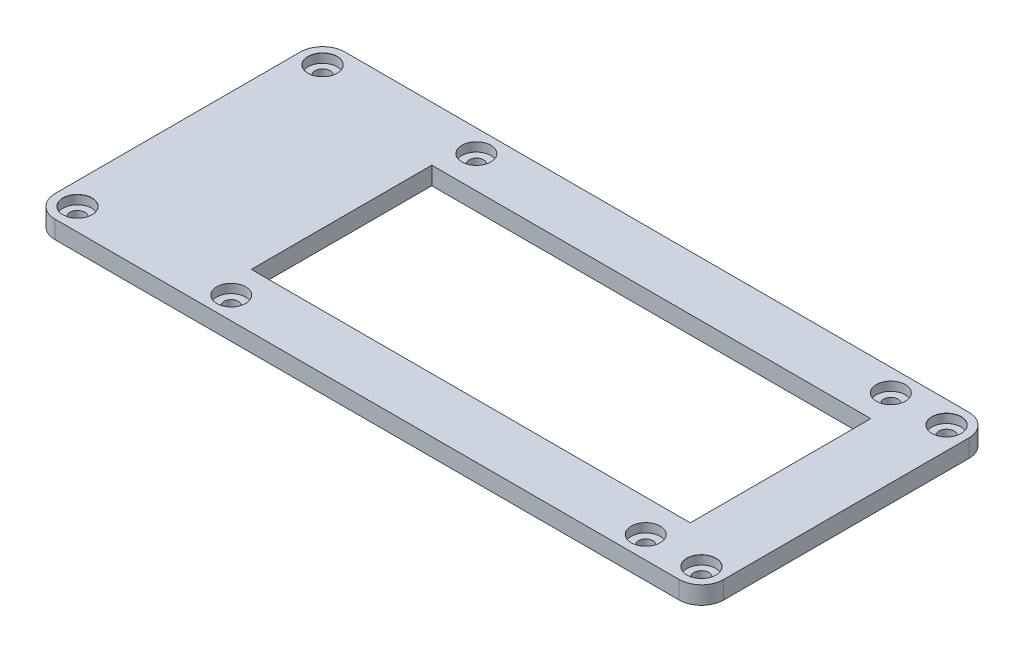
from build123d import *

# Parameters (mm, degrees)
SKETCH1_W                          = 150
SKETCH1_H                          = 65
BODY_DEPTH                         = 4
EDGE_FILLETS_R                     = 5
SKETCH5_W                          = 98.5
SKETCH5_H                          = 40.5
LCD2004_SCREEN_CUTOUT_DEPTH        = 82.836727696
LCD2004_MOUNTING_HOLES_START       = 2
LCD2004_MOUNTING_HOLES_OUTLINE_R   = 3.25
LCD2004_MOUNTING_HOLES_DEPTH       = 2
LCD2004_MOUNTING_HOLES_2_OUTLINE_R = 1.6
LCD2004_MOUNTING_HOLES_2_DEPTH     = 2
SKETCH8_W                          = 50
SKETCH8_H                          = 9.75
LCD2004_SOLDERING_CUTOUT_DEPTH     = 2


# Read off the part's stored shape, not the designer's step: mounting_holes, lcd2004_mounting_holes
with BuildPart() as part:
    # Sketch1 → body (new body)
    with BuildSketch(Plane(origin=(0, 0, 0), x_dir=(1, 0, 0), z_dir=(0, 1, 0))):
        Rectangle(SKETCH1_W, SKETCH1_H)
    extrude(amount=BODY_DEPTH)

    # mounting_holes outline → mounting_holes (revolve, cut)
    with BuildSketch(Plane(origin=(70, 0, 27.5), x_dir=(1, 0, 0), z_dir=(0, 0, 1))):
        Polygon((0, 0), (1.7, 0), (1.7, 2), (3.25, 2), (3.25, 3.975), (3.275, 4), (0, 4), align=None)
    revolve(axis=Axis((70, 0, 27.5), (0, 1, 0)), mode=Mode.SUBTRACT)

    # mounting_holes 2 outline → mounting_holes 2 (revolve, cut)
    with BuildSketch(Plane(origin=(-70, 0, -27.5), x_dir=(1, 0, 0), z_dir=(0, 0, 1))):
        Polygon((0, 4), (0, 0), (1.7, 0), (1.7, 2), (3.25, 2), (3.25, 3.975), (3.275, 4), align=None)
    revolve(axis=Axis((-70, 0, -27.5), (0, 1, 0)), mode=Mode.SUBTRACT)

    # mounting_holes 3 outline → mounting_holes 3 (revolve, cut)
    with BuildSketch(Plane(origin=(70, 0, -27.5), x_dir=(1, 0, 0), z_dir=(0, 0, 1))):
        Polygon((0, 4), (0, 0), (1.7, 0), (1.7, 2), (3.25, 2), (3.25, 3.975), (3.275, 4), align=None)
    revolve(axis=Axis((70, 0, -27.5), (0, 1, 0)), mode=Mode.SUBTRACT)

    # mounting_holes 4 outline → mounting_holes 4 (revolve, cut)
    with BuildSketch(Plane(origin=(-70, 0, 27.5), x_dir=(1, 0, 0), z_dir=(0, 0, 1))):
        Polygon((0, 4), (0, 0), (1.7, 0), (1.7, 2), (3.25, 2), (3.25, 3.975), (3.275, 4), align=None)
    revolve(axis=Axis((-70, 0, 27.5), (0, 1, 0)), mode=Mode.SUBTRACT)

    # edge_fillets
    edge_fillets_edges = [part.edges().sort_by_distance(p)[0] for p in [
        (75, 2, 32.5),
        (-75, 2, 32.5),
        (-75, 2, -32.5),
        (75, 2, -32.5),
    ]]
    fillet(edge_fillets_edges, radius=EDGE_FILLETS_R)

    # Sketch5 → lcd2004_screen_cutout (cut, through all)
    with BuildSketch(Plane(origin=(0, 4, 0), x_dir=(1, 0, 0), z_dir=(0, 1, 0))):
        with Locations((11, 0)):
            Rectangle(SKETCH5_W, SKETCH5_H)
    extrude(amount=-LCD2004_SCREEN_CUTOUT_DEPTH, mode=Mode.SUBTRACT)

    # lcd2004_mounting_holes outline → lcd2004_mounting_holes (cut)
    with BuildSketch(Plane(origin=(0, 0, 0), x_dir=(1, 0, 0), z_dir=(0, 1, 0)).offset(LCD2004_MOUNTING_HOLES_START)):
        with Locations((57.5, 27.5)):
            Circle(LCD2004_MOUNTING_HOLES_OUTLINE_R)
        with Locations((-35.5, -27.5)):
            Circle(LCD2004_MOUNTING_HOLES_OUTLINE_R)
        with Locations((57.5, -27.5)):
            Circle(LCD2004_MOUNTING_HOLES_OUTLINE_R)
        with Locations((-35.5, 27.5)):
            Circle(LCD2004_MOUNTING_HOLES_OUTLINE_R)
    extrude(amount=LCD2004_MOUNTING_HOLES_DEPTH, mode=Mode.SUBTRACT)

    # lcd2004_mounting_holes 2 outline → lcd2004_mounting_holes 2 (cut)
    with BuildSketch(Plane(origin=(0, 0, 0), x_dir=(1, 0, 0), z_dir=(0, 1, 0))):
        with Locations((57.5, 27.5)):
            Circle(LCD2004_MOUNTING_HOLES_2_OUTLINE_R)
        with Locations((-35.5, -27.5)):
            Circle(LCD2004_MOUNTING_HOLES_2_OUTLINE_R)
        with Locations((57.5, -27.5)):
            Circle(LCD2004_MOUNTING_HOLES_2_OUTLINE_R)
        with Locations((-35.5, 27.5)):
            Circle(LCD2004_MOUNTING_HOLES_2_OUTLINE_R)
    extrude(amount=LCD2004_MOUNTING_HOLES_2_DEPTH, mode=Mode.SUBTRACT)

    # Sketch8 → lcd2004_soldering_cutout (cut)
    with BuildSketch(Plane.XZ):
        with Locations((29, 25.125)):
            Rectangle(SKETCH8_W, SKETCH8_H)
    extrude(amount=-LCD2004_SOLDERING_CUTOUT_DEPTH, mode=Mode.SUBTRACT)


solid = part.part
